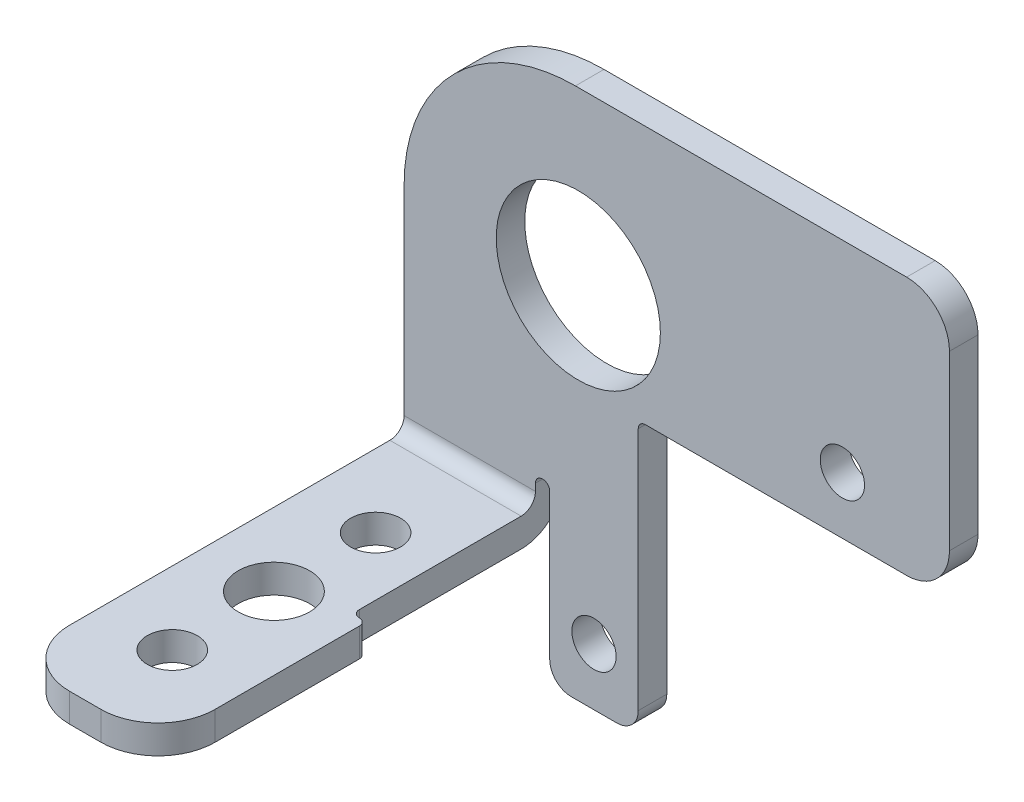
from build123d import *

# Parameters (mm, degrees)
BOSS_EXTRUDE1_DEPTH = 2
BOSS_EXTRUDE2_DEPTH = 9.2
SKETCH3_W           = 9.2
SKETCH3_H           = 2
BOSS_EXTRUDE3_DEPTH = 11.84
SKETCH4_W           = 10.2
SKETCH4_H           = 14.6
BOSS_EXTRUDE4_DEPTH = 2
FILLET1_R           = 3
FILLET2_R           = 12
SKETCH5_R           = 1.55
CUT_EXTRUDE1_DEPTH  = 60.966937557
FILLET3_R           = 1.5
FILLET4_R           = 0.5
FILLET5_R           = 0.5
FILLET6_R           = 4
FILLET7_R           = 0.5
SKETCH6_R           = 5.75
CUT_EXTRUDE2_DEPTH  = 60.966937557
SKETCH7_R           = 1.75
SKETCH7_R_2         = 2.5
CUT_EXTRUDE3_DEPTH  = 56.271634678


with BuildPart() as part:
    # Sketch1 → Boss-Extrude1 (new body)
    with BuildSketch(Plane.XY):
        Polygon((0, 0), (-38.2, 0), (-38.2, -26), (-29, -26), (-29, -25), (-28, -25), (-28, -37.2), (-21.8, -37.2), (-21.8, -18.1), (0, -18.1), align=None)
    extrude(amount=BOSS_EXTRUDE1_DEPTH)

    # Sketch2 → Boss-Extrude2 (add)
    with BuildSketch(Plane.ZY.offset(38.2)):
        with BuildLine():
            Line((0, -26), (2, -26))
            ThreePointArc((2, -26), (2.292893219, -26.707106781), (3, -27))
            Line((3, -27), (3, -29))
            ThreePointArc((3, -29), (0.878679656, -28.121320344), (0, -26))
        make_face()
    extrude(amount=-BOSS_EXTRUDE2_DEPTH)

    # Sketch3 → Boss-Extrude3 (add)
    with BuildSketch(Plane.XY.offset(3)):
        with Locations((-33.6, -28)):
            Rectangle(SKETCH3_W, SKETCH3_H)
    extrude(amount=BOSS_EXTRUDE3_DEPTH)

    # Sketch4 → Boss-Extrude4 (add)
    with BuildSketch(Plane(origin=(0, -27, 0), x_dir=(1, 0, 0), z_dir=(0, 1, 0))):
        with Locations((-33.1, -22.14)):
            Rectangle(SKETCH4_W, SKETCH4_H)
    extrude(amount=-BOSS_EXTRUDE4_DEPTH)

    # Fillet1
    fillet1_edges = [part.edges().sort_by_distance(p)[0] for p in [
        (0, -18.1, 1),
        (0, 0, 1),
    ]]
    fillet(fillet1_edges, radius=FILLET1_R)

    # Fillet2
    fillet2_edges = [part.edges().sort_by_distance(p)[0] for p in [
        (-38.2, 0, 1),
    ]]
    fillet(fillet2_edges, radius=FILLET2_R)

    # Sketch5 → Cut-Extrude1 (cut, through all)
    with BuildSketch(Plane.XY.offset(2)):
        with Locations((-7.5, -14.1)):
            Circle(SKETCH5_R)
        with Locations((-24.9, -33.2)):
            Circle(SKETCH5_R)
    extrude(amount=-CUT_EXTRUDE1_DEPTH, mode=Mode.SUBTRACT)

    # Fillet3
    fillet3_edges = [part.edges().sort_by_distance(p)[0] for p in [
        (-21.8, -37.2, 1),
        (-28, -37.2, 1),
    ]]
    fillet(fillet3_edges, radius=FILLET3_R)

    # Fillet4
    fillet4_edges = [part.edges().sort_by_distance(p)[0] for p in [
        (-28, -25, 1),
        (-29, -25, 1),
    ]]
    fillet(fillet4_edges, radius=FILLET4_R - 0.0001)  # a hair under: the kernel refuses the full size

    # Fillet5
    fillet5_edges = [part.edges().sort_by_distance(p)[0] for p in [
        (-29, -28, 14.84),
    ]]
    fillet(fillet5_edges, radius=FILLET5_R)
    fillet5_2_edges = [part.edges().sort_by_distance(p)[0] for p in [
        (-28, -28, 14.84),
    ]]
    fillet(fillet5_2_edges, radius=FILLET5_R - 0.0001)  # a hair under: the kernel refuses the full size

    # Fillet6
    fillet6_edges = [part.edges().sort_by_distance(p)[0] for p in [
        (-38.2, -28, 29.44),
        (-28, -28, 29.44),
    ]]
    fillet(fillet6_edges, radius=FILLET6_R)

    # Fillet7
    fillet7_edges = [part.edges().sort_by_distance(p)[0] for p in [
        (-21.8, -18.1, 1),
    ]]
    fillet(fillet7_edges, radius=FILLET7_R)

    # Sketch6 → Cut-Extrude2 (cut, through all)
    with BuildSketch(Plane.XY.offset(2)):
        with Locations((-26, -12)):
            Circle(SKETCH6_R)
    extrude(amount=-CUT_EXTRUDE2_DEPTH, mode=Mode.SUBTRACT)

    # Sketch7 → Cut-Extrude3 (cut, through all)
    with BuildSketch(Plane(origin=(0, -27, 0), x_dir=(1, 0, 0), z_dir=(0, 1, 0))):
        with Locations(Location((-33.1, -23.342208336, 0), (0, 0, 270))):
            Circle(SKETCH7_R)
        with Locations(Location((-33.1, -9.097791664, 0), (0, 0, 270))):
            Circle(SKETCH7_R)
        with Locations(Location((-33.1, -16.22, 0), (0, 0, 270))):
            Circle(SKETCH7_R_2)
    extrude(amount=-CUT_EXTRUDE3_DEPTH, mode=Mode.SUBTRACT)


solid = part.part
